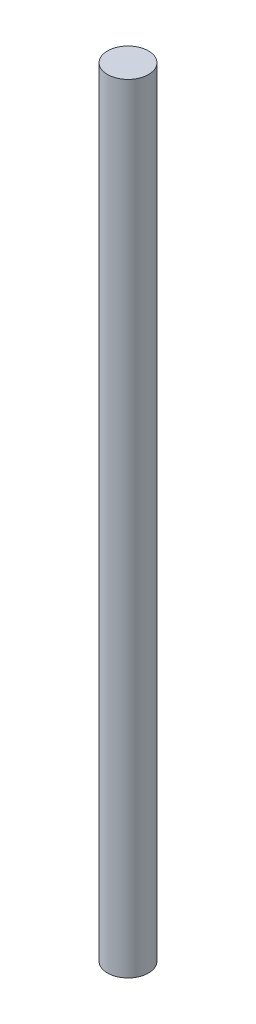
from build123d import *

# Parameters (mm, degrees)
SKETCH1_R           = 1.5875
BOSS_EXTRUDE1_DEPTH = 60.325


with BuildPart() as part:
    # Sketch1 → Boss-Extrude1 (new body)
    with BuildSketch(Plane(origin=(0, 0, 0), x_dir=(1, 0, 0), z_dir=(0, 1, 0))):
        with Locations((-41.164795015, -11.440642282)):
            Circle(SKETCH1_R)
    extrude(amount=BOSS_EXTRUDE1_DEPTH)


solid = part.part
